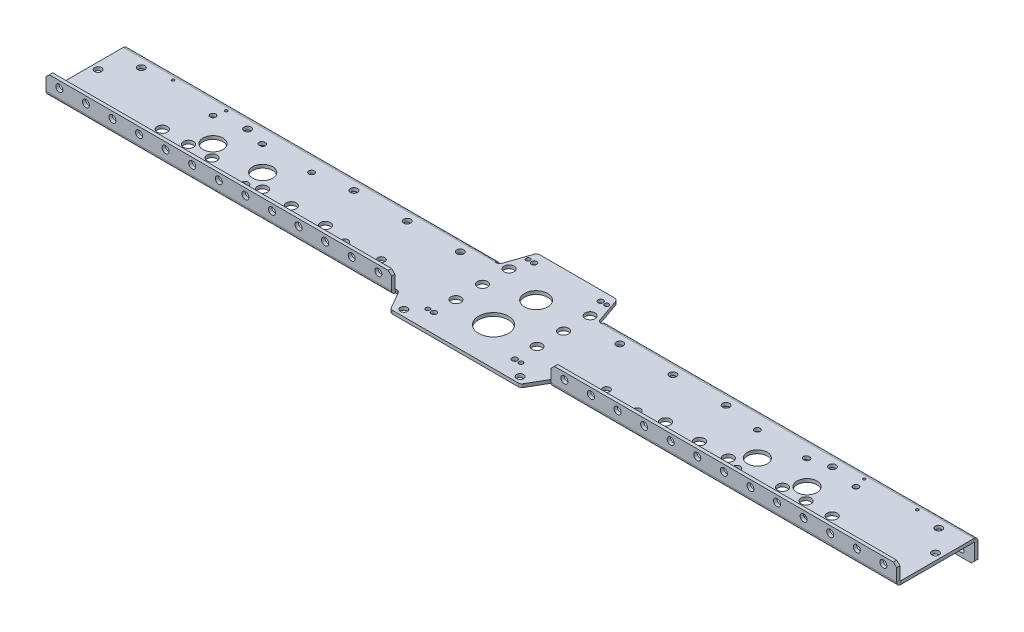
from build123d import *

# Parameters (mm, degrees)
BASE_FLANGE1_DEPTH           = 3.175
CUT_EXTRUDE1_DEPTH           = 819.607175725
CUT_EXTRUDE2_DEPTH           = 819.607175725
CUT_EXTRUDE3_DEPTH           = 819.607175725
CUT_EXTRUDE4_DEPTH           = 819.607175725
HOLE1_D                      = 28.575
HOLE2_D                      = 9.652
F_7_8_0_875_DIAMETER_HOLE1_D = 22.225
F_3_8_0_375_DIAMETER_HOLE1_D = 9.525
F_10_CLEARANCE_HOLE1_D       = 5.08
F_6_CLEARANCE_HOLE1_D        = 4.064
F_1_4_CLEARANCE_HOLE1_D      = 6.7056
F_2_CLEARANCE_HOLE1_D        = 2.54
F_1_4_CLEARANCE_HOLE2_D      = 6.8072
F_10_CLEARANCE_HOLE2_D       = 5.334
F_3_4_0_75_DIAMETER_HOLE1_D  = 19.05
F_10_CLEARANCE_HOLE3_D       = 5.334
F_3_4_0_75_DIAMETER_HOLE2_D  = 19.05
EDGE_FLANGE1_DEPTH           = 355.6
EDGE_FLANGE1_START           = 3.175
EDGE_FLANGE1_PROFILE_R       = 2.667
EDGE_FLANGE1_FLAT_DEPTH      = 3.175
EDGE_FLANGE2_DEPTH           = 330.2
EDGE_FLANGE2_START           = 3.175
EDGE_FLANGE2_PROFILE_R       = 3.3528
EDGE_FLANGE2_FLAT_DEPTH      = 3.175
EDGE_FLANGE3_DEPTH           = 330.2
EDGE_FLANGE3_START           = 3.175
EDGE_FLANGE3_PROFILE_R       = 3.3528
EDGE_FLANGE3_FLAT_DEPTH      = 3.175
EDGE_FLANGE4_DEPTH           = 355.6
EDGE_FLANGE4_START           = 3.175
EDGE_FLANGE4_PROFILE_R       = 2.667
EDGE_FLANGE4_FLAT_DEPTH      = 3.175


# Sheet-metal steps are written as plain solids
with BuildPart() as part:
    # Sketch11 → Base-Flange1 (new body)
    with BuildSketch(Plane.XZ):
        with BuildLine():
            Line((359.512315987, -71.99132111), (367.483279101, -95.14067889))
            ThreePointArc((367.483279101, -95.14067889), (368.641568694, -96.691816771), (370.485300578, -97.282))
            Line((370.485300578, -97.282), (442.314699422, -97.282))
            ThreePointArc((442.314699422, -97.282), (444.158431306, -96.691816771), (445.316720899, -95.14067889))
            Line((445.316720899, -95.14067889), (453.287684013, -71.99132111))
            ThreePointArc((453.287684013, -71.99132111), (454.445973606, -70.440183229), (456.289705491, -69.85))
            Line((456.289705491, -69.85), (812.8, -69.85))
            Line((812.8, -69.85), (812.8, 0))
            Line((812.8, 0), (481.258087105, 0))
            ThreePointArc((481.258087105, 0), (479.670587105, 0.425369343), (478.508456448, 1.5875))
            Line((478.508456448, 1.5875), (469.343020924, 17.4625))
            ThreePointArc((469.343020924, 17.4625), (468.180890267, 18.624630657), (466.593390267, 19.05))
            Line((466.593390267, 19.05), (346.206609733, 19.05))
            ThreePointArc((346.206609733, 19.05), (344.619109733, 18.624630657), (343.456979076, 17.4625))
            Line((343.456979076, 17.4625), (334.291543552, 1.5875))
            ThreePointArc((334.291543552, 1.5875), (333.129412895, 0.425369343), (331.541912895, 0))
            Line((331.541912895, 0), (0, 0))
            Line((0, 0), (0, -69.85))
            Line((0, -69.85), (356.510294509, -69.85))
            ThreePointArc((356.510294509, -69.85), (358.354026394, -70.440183229), (359.512315987, -71.99132111))
        make_face()
    extrude(amount=-BASE_FLANGE1_DEPTH)

    # Sketch16 → Cut-Extrude1 (cut, through all)
    with BuildSketch(Plane.XZ):
        with BuildLine():
            ThreePointArc((146.344911761, -53.730859888), (143.28437858, -56.368665915), (146.344911761, -59.006471942))
            ThreePointArc((146.344911761, -59.006471942), (149.405444942, -56.368665915), (146.344911761, -53.730859888))
        make_face()
    extrude(amount=-CUT_EXTRUDE1_DEPTH, mode=Mode.SUBTRACT)

    # Sketch17 → Cut-Extrude2 (cut, through all)
    with BuildSketch(Plane.XZ):
        with BuildLine():
            ThreePointArc((666.455088239, -12.309140112), (669.51562142, -9.671334085), (666.455088239, -7.033528058))
            ThreePointArc((666.455088239, -7.033528058), (663.394555058, -9.671334085), (666.455088239, -12.309140112))
        make_face()
    extrude(amount=-CUT_EXTRUDE2_DEPTH, mode=Mode.SUBTRACT)

    # Sketch18 → Cut-Extrude3 (cut, through all)
    with BuildSketch(Plane.XZ):
        with BuildLine():
            ThreePointArc((666.455088239, -59.006471942), (669.51562142, -56.368665915), (666.455088239, -53.730859888))
            ThreePointArc((666.455088239, -53.730859888), (663.394555058, -56.368665915), (666.455088239, -59.006471942))
        make_face()
    extrude(amount=-CUT_EXTRUDE3_DEPTH, mode=Mode.SUBTRACT)

    # Sketch19 → Cut-Extrude4 (cut, through all)
    with BuildSketch(Plane(origin=(0, 3.175, 0), x_dir=(-1, 0, 0), z_dir=(0, 1, 0))):
        with BuildLine():
            ThreePointArc((-146.344911761, -7.033528058), (-149.405444942, -9.671334085), (-146.344911761, -12.309140112))
            ThreePointArc((-146.344911761, -12.309140112), (-143.28437858, -9.671334085), (-146.344911761, -7.033528058))
        make_face()
    extrude(amount=-CUT_EXTRUDE4_DEPTH, mode=Mode.SUBTRACT)

    # Hole1 (through all)
    with Locations(Plane(origin=(0, 3.175, 0), x_dir=(1, 0, 0), z_dir=(0, 1, 0))):
        with Locations((406.4, 17.272)):
            Hole(HOLE1_D / 2)

    # Hole2 (through all)
    with Locations(Plane(origin=(0, 3.175, 0), x_dir=(1, 0, 0), z_dir=(0, 1, 0))):
        with Locations((628.947697627, 19.05), (601.438495912, 19.05), (568.924874752, 19.05), (243.875125248, 19.05), (211.361504088, 19.05), (183.852302373, 19.05), (678.944202666, 20.828), (701.450372003, 20.828), (726.460886343, 20.828), (133.855797334, 20.828), (111.349627997, 20.828), (86.339113657, 20.828)):
            Hole(HOLE2_D / 2)

    # 7/8 (0.875) Diameter Hole1 (through all)
    with Locations(Plane(origin=(0, 0, 0), x_dir=(-1, 0, 0), z_dir=(0, -1, 0))):
        with Locations((-406.4, 57.9628)):
            Hole(F_7_8_0_875_DIAMETER_HOLE1_D / 2)

    # 3/8 (0.375) Diameter Hole1 (through all)
    with Locations(Plane(origin=(0, 0, 0), x_dir=(-1, 0, 0), z_dir=(0, -1, 0))):
        with Locations((-367.67570279, 70.866), (-367.67570279, 20.066), (-445.12429721, 20.066), (-445.12429721, 70.866), (-367.67570279, 45.466), (-445.12429721, 45.466)):
            Hole(F_3_8_0_375_DIAMETER_HOLE1_D / 2)

    # #10 Clearance Hole1 (through all)
    with Locations(Plane(origin=(0, 0, 0), x_dir=(-1, 0, 0), z_dir=(0, -1, 0))):
        with Locations((-367.7539, -1.03886), (-445.0461, -1.03886), (-374.65, 87.85352), (-438.15, 87.85352)):
            Hole(F_10_CLEARANCE_HOLE1_D / 2)

    # #6 Clearance Hole1 (through all)
    with Locations(Plane(origin=(0, 0, 0), x_dir=(-1, 0, 0), z_dir=(0, -1, 0))):
        with Locations((-450.8881, -1.03886), (-361.9119, -1.03886), (-368.808, 87.85352), (-443.992, 87.85352)):
            Hole(F_6_CLEARANCE_HOLE1_D / 2)

    # 1/4 Clearance Hole1 (through all)
    with Locations(Plane(origin=(0, 0, 0), x_dir=(-1, 0, 0), z_dir=(0, -1, 0))):
        with Locations((-806.45, 39.497), (-6.35, 39.497), (-787.4, 61.722), (-685.8, 61.722), (-584.2, 61.722), (-533.4, 61.722), (-482.6, 61.722), (-25.4, 61.722), (-127, 61.722), (-228.6, 61.722), (-279.4, 61.722), (-330.2, 61.722)):
            Hole(F_1_4_CLEARANCE_HOLE1_D / 2)

    # #2 Clearance Hole1 (through all)
    with Locations(Plane(origin=(0, 0, 0), x_dir=(-1, 0, 0), z_dir=(0, -1, 0))):
        with Locations((-711.2, 66.675), (-711.2, 3.175), (-762, 3.175), (-762, 66.675), (-50.8, 3.175), (-50.8, 66.675), (-101.6, 66.675), (-101.6, 3.175)):
            Hole(F_2_CLEARANCE_HOLE1_D / 2)

    # 1/4 Clearance Hole2 (through all)
    with Locations(Plane(origin=(0, 3.175, 0), x_dir=(1, 0, 0), z_dir=(0, 1, 0))):
        with Locations((461.9625, -12.8905), (350.8375, -12.8905), (641.35, 14.732), (546.1, 14.732), (266.7, 14.732), (171.45, 14.732), (513.925467617, 17.547282407), (298.874532383, 17.547282407)):
            Hole(F_1_4_CLEARANCE_HOLE2_D / 2)

    # #10 Clearance Hole2 (through all)
    with Locations(Plane(origin=(0, 3.175, 0), x_dir=(1, 0, 0), z_dir=(0, 1, 0))):
        with Locations((99.254046751, 9.671334085), (99.254046751, 56.368665915), (713.545953249, 56.368665915), (713.545953249, 9.671334085)):
            Hole(F_10_CLEARANCE_HOLE2_D / 2)

    # 3/4 (0.75) Diameter Hole1 (through all)
    with Locations(Plane(origin=(0, 3.175, 0), x_dir=(1, 0, 0), z_dir=(0, 1, 0))):
        with Locations((122.602712665, 33.02), (690.197287335, 33.02)):
            Hole(F_3_4_0_75_DIAMETER_HOLE1_D / 2)

    # #10 Clearance Hole3 (through all)
    with Locations(Plane(origin=(0, 0, 0), x_dir=(-1, 0, 0), z_dir=(0, -1, 0))):
        with Locations((-619.364223229, 9.671334085), (-619.364223229, 56.368665915), (-193.435776771, 56.368665915), (-193.435776771, 9.671334085)):
            Hole(F_10_CLEARANCE_HOLE3_D / 2)

    # 3/4 (0.75) Diameter Hole2 (through all)
    with Locations(Plane(origin=(0, 0, 0), x_dir=(-1, 0, 0), z_dir=(0, -1, 0))):
        with Locations((-170.087110857, 33.02), (-642.712889143, 33.02)):
            Hole(F_3_4_0_75_DIAMETER_HOLE2_D / 2)

    # Edge-Flange1 bend section (across the edge) → Edge-Flange1 (add)
    with BuildSketch(Plane(origin=(457.2, 0, -70.612), x_dir=(0, 0, 1), z_dir=(1, 0, 0))):
        with BuildLine():
            Line((-3.175, 0.762), (0, 0.762))
            ThreePointArc((0, 0.762), (0.223184633, 0.223184633), (0.762, 0))
            Line((0.762, 0), (0.762, -3.175))
            ThreePointArc((0.762, -3.175), (-2.021879398, -2.021879398), (-3.175, 0.762))
        make_face()
    extrude(amount=EDGE_FLANGE1_DEPTH)

    # Edge-Flange1 profile (on flange) → Edge-Flange1 flat (add)
    with BuildSketch(Plane(origin=(0, 0, -70.612), x_dir=(1, 0, 0), z_dir=(0, 0, -1)).offset(EDGE_FLANGE1_START)):
        Polygon((457.2, 0.762), (812.8, 0.762), (812.8, 15.875), (809.625, 19.05), (460.375, 19.05), (457.2, 15.875), align=None)
        with Locations((622.3, 12.7)):
            Circle(EDGE_FLANGE1_PROFILE_R, mode=Mode.SUBTRACT)
        with Locations((596.9, 12.7)):
            Circle(EDGE_FLANGE1_PROFILE_R, mode=Mode.SUBTRACT)
        with Locations((571.5, 12.7)):
            Circle(EDGE_FLANGE1_PROFILE_R, mode=Mode.SUBTRACT)
        with Locations((546.1, 12.7)):
            Circle(EDGE_FLANGE1_PROFILE_R, mode=Mode.SUBTRACT)
        with Locations((520.7, 12.7)):
            Circle(EDGE_FLANGE1_PROFILE_R, mode=Mode.SUBTRACT)
        with Locations((495.3, 12.7)):
            Circle(EDGE_FLANGE1_PROFILE_R, mode=Mode.SUBTRACT)
        with Locations((469.9, 12.7)):
            Circle(EDGE_FLANGE1_PROFILE_R, mode=Mode.SUBTRACT)
        with Locations((800.1, 12.7)):
            Circle(EDGE_FLANGE1_PROFILE_R, mode=Mode.SUBTRACT)
        with Locations((774.7, 12.7)):
            Circle(EDGE_FLANGE1_PROFILE_R, mode=Mode.SUBTRACT)
        with Locations((749.3, 12.7)):
            Circle(EDGE_FLANGE1_PROFILE_R, mode=Mode.SUBTRACT)
        with Locations((723.9, 12.7)):
            Circle(EDGE_FLANGE1_PROFILE_R, mode=Mode.SUBTRACT)
        with Locations((698.5, 12.7)):
            Circle(EDGE_FLANGE1_PROFILE_R, mode=Mode.SUBTRACT)
        with Locations((673.1, 12.7)):
            Circle(EDGE_FLANGE1_PROFILE_R, mode=Mode.SUBTRACT)
        with Locations((647.7, 12.7)):
            Circle(EDGE_FLANGE1_PROFILE_R, mode=Mode.SUBTRACT)
    extrude(amount=-EDGE_FLANGE1_FLAT_DEPTH)

    # Edge-Flange2 bend section (across the edge) → Edge-Flange2 (add)
    with BuildSketch(Plane(origin=(482.6, 3.175, 0.762), x_dir=(0, 0, -1), z_dir=(1, 0, 0))):
        with BuildLine():
            Line((-3.175, 0.762), (0, 0.762))
            ThreePointArc((0, 0.762), (0.223184633, 0.223184633), (0.762, 0))
            Line((0.762, 0), (0.762, -3.175))
            ThreePointArc((0.762, -3.175), (-2.021879398, -2.021879398), (-3.175, 0.762))
        make_face()
    extrude(amount=EDGE_FLANGE2_DEPTH)

    # Edge-Flange2 profile (on flange) → Edge-Flange2 flat (add)
    with BuildSketch(Plane(origin=(0, 3.175, 0.762), x_dir=(1, 0, 0), z_dir=(0, 0, 1)).offset(EDGE_FLANGE2_START)):
        Polygon((482.6, 0.762), (812.8, 0.762), (812.8, 12.7), (809.625, 15.875), (485.775, 15.875), (482.6, 12.7), align=None)
        with Locations((800.1, 9.525)):
            Circle(EDGE_FLANGE2_PROFILE_R, mode=Mode.SUBTRACT)
        with Locations((774.7, 9.525)):
            Circle(EDGE_FLANGE2_PROFILE_R, mode=Mode.SUBTRACT)
        with Locations((749.3, 9.525)):
            Circle(EDGE_FLANGE2_PROFILE_R, mode=Mode.SUBTRACT)
        with Locations((723.9, 9.525)):
            Circle(EDGE_FLANGE2_PROFILE_R, mode=Mode.SUBTRACT)
        with Locations((698.5, 9.525)):
            Circle(EDGE_FLANGE2_PROFILE_R, mode=Mode.SUBTRACT)
        with Locations((673.1, 9.525)):
            Circle(EDGE_FLANGE2_PROFILE_R, mode=Mode.SUBTRACT)
        with Locations((647.7, 9.525)):
            Circle(EDGE_FLANGE2_PROFILE_R, mode=Mode.SUBTRACT)
        with Locations((622.3, 9.525)):
            Circle(EDGE_FLANGE2_PROFILE_R, mode=Mode.SUBTRACT)
        with Locations((596.9, 9.525)):
            Circle(EDGE_FLANGE2_PROFILE_R, mode=Mode.SUBTRACT)
        with Locations((571.5, 9.525)):
            Circle(EDGE_FLANGE2_PROFILE_R, mode=Mode.SUBTRACT)
        with Locations((546.1, 9.525)):
            Circle(EDGE_FLANGE2_PROFILE_R, mode=Mode.SUBTRACT)
        with Locations((520.7, 9.525)):
            Circle(EDGE_FLANGE2_PROFILE_R, mode=Mode.SUBTRACT)
        with Locations((495.3, 9.525)):
            Circle(EDGE_FLANGE2_PROFILE_R, mode=Mode.SUBTRACT)
    extrude(amount=-EDGE_FLANGE2_FLAT_DEPTH)

    # Edge-Flange3 bend section (across the edge) → Edge-Flange3 (add)
    with BuildSketch(Plane(origin=(0, 3.175, 0.762), x_dir=(0, 0, -1), z_dir=(1, 0, 0))):
        with BuildLine():
            Line((-3.175, 0.762), (0, 0.762))
            ThreePointArc((0, 0.762), (0.223184633, 0.223184633), (0.762, 0))
            Line((0.762, 0), (0.762, -3.175))
            ThreePointArc((0.762, -3.175), (-2.021879398, -2.021879398), (-3.175, 0.762))
        make_face()
    extrude(amount=EDGE_FLANGE3_DEPTH)

    # Edge-Flange3 profile (on flange) → Edge-Flange3 flat (add)
    with BuildSketch(Plane(origin=(0, 3.175, 0.762), x_dir=(1, 0, 0), z_dir=(0, 0, 1)).offset(EDGE_FLANGE3_START)):
        Polygon((330.2, 0.762), (330.2, 12.7), (327.025, 15.875), (3.175, 15.875), (0, 12.7), (0, 0.762), align=None)
        with Locations((317.5, 9.525)):
            Circle(EDGE_FLANGE3_PROFILE_R, mode=Mode.SUBTRACT)
        with Locations((292.1, 9.525)):
            Circle(EDGE_FLANGE3_PROFILE_R, mode=Mode.SUBTRACT)
        with Locations((266.7, 9.525)):
            Circle(EDGE_FLANGE3_PROFILE_R, mode=Mode.SUBTRACT)
        with Locations((241.3, 9.525)):
            Circle(EDGE_FLANGE3_PROFILE_R, mode=Mode.SUBTRACT)
        with Locations((215.9, 9.525)):
            Circle(EDGE_FLANGE3_PROFILE_R, mode=Mode.SUBTRACT)
        with Locations((190.5, 9.525)):
            Circle(EDGE_FLANGE3_PROFILE_R, mode=Mode.SUBTRACT)
        with Locations((165.1, 9.525)):
            Circle(EDGE_FLANGE3_PROFILE_R, mode=Mode.SUBTRACT)
        with Locations((139.7, 9.525)):
            Circle(EDGE_FLANGE3_PROFILE_R, mode=Mode.SUBTRACT)
        with Locations((114.3, 9.525)):
            Circle(EDGE_FLANGE3_PROFILE_R, mode=Mode.SUBTRACT)
        with Locations((88.9, 9.525)):
            Circle(EDGE_FLANGE3_PROFILE_R, mode=Mode.SUBTRACT)
        with Locations((63.5, 9.525)):
            Circle(EDGE_FLANGE3_PROFILE_R, mode=Mode.SUBTRACT)
        with Locations((38.1, 9.525)):
            Circle(EDGE_FLANGE3_PROFILE_R, mode=Mode.SUBTRACT)
        with Locations((12.7, 9.525)):
            Circle(EDGE_FLANGE3_PROFILE_R, mode=Mode.SUBTRACT)
    extrude(amount=-EDGE_FLANGE3_FLAT_DEPTH)

    # Edge-Flange4 bend section (across the edge) → Edge-Flange4 (add)
    with BuildSketch(Plane(origin=(0, 0, -70.612), x_dir=(0, 0, 1), z_dir=(1, 0, 0))):
        with BuildLine():
            Line((-3.175, 0.762), (0, 0.762))
            ThreePointArc((0, 0.762), (0.223184633, 0.223184633), (0.762, 0))
            Line((0.762, 0), (0.762, -3.175))
            ThreePointArc((0.762, -3.175), (-2.021879398, -2.021879398), (-3.175, 0.762))
        make_face()
    extrude(amount=EDGE_FLANGE4_DEPTH)

    # Edge-Flange4 profile (on flange) → Edge-Flange4 flat (add)
    with BuildSketch(Plane(origin=(0, 0, -70.612), x_dir=(1, 0, 0), z_dir=(0, 0, -1)).offset(EDGE_FLANGE4_START)):
        Polygon((355.6, 0.762), (355.6, 15.875), (352.425, 19.05), (3.175, 19.05), (0, 15.875), (0, 0.762), align=None)
        with Locations((114.3, 12.7)):
            Circle(EDGE_FLANGE4_PROFILE_R, mode=Mode.SUBTRACT)
        with Locations((88.9, 12.7)):
            Circle(EDGE_FLANGE4_PROFILE_R, mode=Mode.SUBTRACT)
        with Locations((63.5, 12.7)):
            Circle(EDGE_FLANGE4_PROFILE_R, mode=Mode.SUBTRACT)
        with Locations((38.1, 12.7)):
            Circle(EDGE_FLANGE4_PROFILE_R, mode=Mode.SUBTRACT)
        with Locations((12.7, 12.7)):
            Circle(EDGE_FLANGE4_PROFILE_R, mode=Mode.SUBTRACT)
        with Locations((342.9, 12.7)):
            Circle(EDGE_FLANGE4_PROFILE_R, mode=Mode.SUBTRACT)
        with Locations((317.5, 12.7)):
            Circle(EDGE_FLANGE4_PROFILE_R, mode=Mode.SUBTRACT)
        with Locations((292.1, 12.7)):
            Circle(EDGE_FLANGE4_PROFILE_R, mode=Mode.SUBTRACT)
        with Locations((266.7, 12.7)):
            Circle(EDGE_FLANGE4_PROFILE_R, mode=Mode.SUBTRACT)
        with Locations((241.3, 12.7)):
            Circle(EDGE_FLANGE4_PROFILE_R, mode=Mode.SUBTRACT)
        with Locations((215.9, 12.7)):
            Circle(EDGE_FLANGE4_PROFILE_R, mode=Mode.SUBTRACT)
        with Locations((190.5, 12.7)):
            Circle(EDGE_FLANGE4_PROFILE_R, mode=Mode.SUBTRACT)
        with Locations((165.1, 12.7)):
            Circle(EDGE_FLANGE4_PROFILE_R, mode=Mode.SUBTRACT)
        with Locations((139.7, 12.7)):
            Circle(EDGE_FLANGE4_PROFILE_R, mode=Mode.SUBTRACT)
    extrude(amount=-EDGE_FLANGE4_FLAT_DEPTH)


solid = part.part
